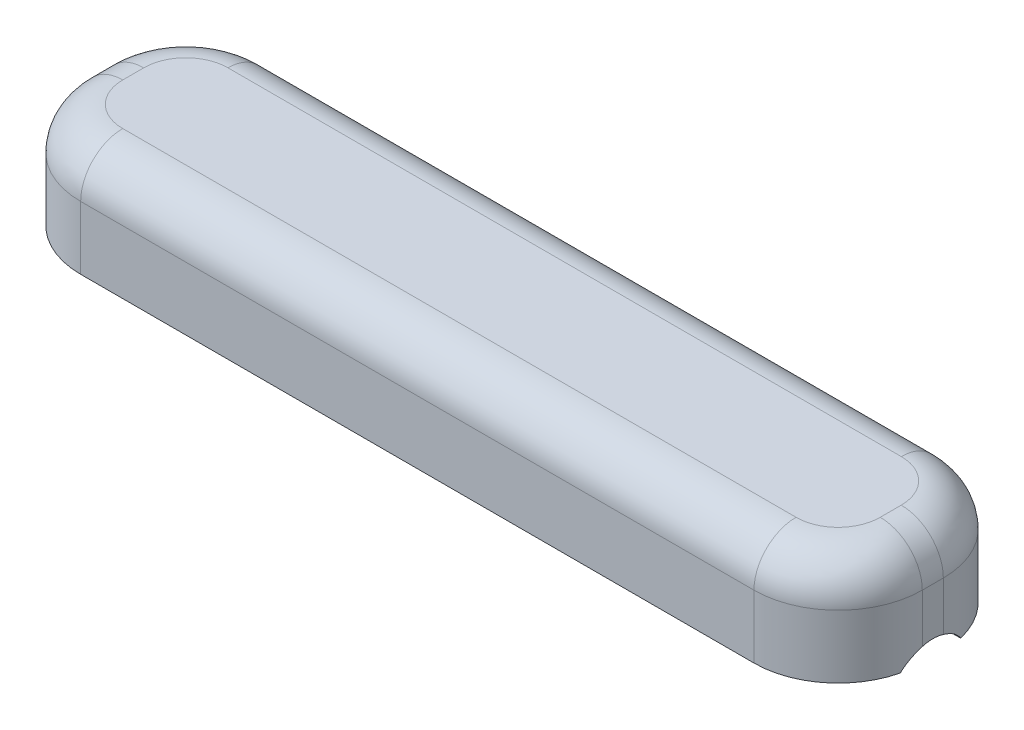
from build123d import *

# Parameters (mm, degrees)
SKETCH1_W               = 254
SKETCH1_H               = 57.15
BOSS_EXTRUDE1_DEPTH     = 31.75
FILLET1_R               = 12.7
FILLET2_R               = 25.4
CUT_EXTRUDE1_DEPTH      = 134.991018822
CUT_EXTRUDE1_DEPTH_BACK = 134.991018822
SKETCH2_R               = 11.1125


with BuildPart() as part:
    # Sketch1 → Boss-Extrude1 (new body)
    with BuildSketch(Plane(origin=(0, 0, 0), x_dir=(1, 0, 0), z_dir=(0, 1, 0))):
        Rectangle(SKETCH1_W, SKETCH1_H)
    extrude(amount=BOSS_EXTRUDE1_DEPTH)

    # Fillet1
    fillet1_edges = [part.edges().sort_by_distance(p)[0] for p in [
        (-127, 31.75, 0),
        (0, 31.75, 28.575),
        (127, 31.75, 0),
        (0, 31.75, -28.575),
    ]]
    fillet(fillet1_edges, radius=FILLET1_R)

    # Fillet2
    # the kernel refuses this fillet: 25.4 mm, written as the material it takes off along each edge
    with BuildSketch(Plane(origin=(101.6, 31.75, -3.175), x_dir=(1, 0, 0), z_dir=(0, 0, 1))) as fillet2_piece_1:
        with BuildLine():
            CenterArc((12.7, -12.7), 12.7, 0, 90)
            Line((25.4, -12.7), (25.4, 0))
            Line((25.4, 0), (12.7, 0))
        make_face()
    revolve(axis=Axis((101.6, 31.75, -3.175), (0, 1, 0)), revolution_arc=90, mode=Mode.SUBTRACT)
    with BuildSketch(Plane(origin=(101.6, 31.75, 3.175), x_dir=(0, 0, 1), z_dir=(-1, 0, 0))) as fillet2_piece_2:
        with BuildLine():
            CenterArc((12.7, -12.7), 12.7, 0, 90)
            Line((25.4, -12.7), (25.4, 0))
            Line((25.4, 0), (12.7, 0))
        make_face()
    revolve(axis=Axis((101.6, 31.75, 3.175), (0, 1, 0)), revolution_arc=90, mode=Mode.SUBTRACT)
    with BuildSketch(Plane(origin=(-101.6, 31.75, -3.175), x_dir=(0, 0, -1), z_dir=(1, 0, 0))) as fillet2_piece_3:
        with BuildLine():
            CenterArc((12.7, -12.7), 12.7, 0, 90)
            Line((25.4, -12.7), (25.4, 0))
            Line((25.4, 0), (12.7, 0))
        make_face()
    revolve(axis=Axis((-101.6, 31.75, -3.175), (0, 1, 0)), revolution_arc=90, mode=Mode.SUBTRACT)
    with BuildSketch(Plane(origin=(-101.6, 31.75, 3.175), x_dir=(-1, 0, 0), z_dir=(0, 0, -1))) as fillet2_piece_4:
        with BuildLine():
            CenterArc((12.7, -12.7), 12.7, 0, 90)
            Line((25.4, -12.7), (25.4, 0))
            Line((25.4, 0), (12.7, 0))
        make_face()
    revolve(axis=Axis((-101.6, 31.75, 3.175), (0, 1, 0)), revolution_arc=90, mode=Mode.SUBTRACT)
    with BuildSketch(Plane(origin=(-127, -63.5, 28.575), x_dir=(0, 0, -1), z_dir=(0, 1, 0)), Plane(origin=(-127, -63.5, -28.575), x_dir=(1, 0, 0), z_dir=(0, 1, 0))) as fillet2_piece_5:
        with BuildLine():
            CenterArc((FILLET2_R, -FILLET2_R), FILLET2_R, 90, 90)
            Line((0, -FILLET2_R), (0, 0))
            Line((0, 0), (FILLET2_R, 0))
        make_face()
    extrude(amount=95.25, mode=Mode.SUBTRACT)
    with BuildSketch(Plane(origin=(127, -63.5, -28.575), x_dir=(-1, 0, 0), z_dir=(0, 1, 0)), Plane(origin=(127, -63.5, 28.575), x_dir=(0, 0, -1), z_dir=(0, 1, 0))) as fillet2_piece_6:
        with BuildLine():
            CenterArc((FILLET2_R, FILLET2_R), FILLET2_R, 180, 90)
            Line((0, FILLET2_R), (0, 0))
            Line((0, 0), (FILLET2_R, 0))
        make_face()
    extrude(amount=95.25, mode=Mode.SUBTRACT)

    # Sketch2 → Cut-Extrude1 (cut, two sides: drawn at the far end of the back side and taken through both)
    with BuildSketch(Plane(origin=(0, 0, 0), x_dir=(0, 0, -1), z_dir=(1, 0, 0)).offset(-CUT_EXTRUDE1_DEPTH_BACK)):
        with Locations((0, -6.35)):
            Circle(SKETCH2_R)
    extrude(amount=CUT_EXTRUDE1_DEPTH + CUT_EXTRUDE1_DEPTH_BACK, mode=Mode.SUBTRACT)


solid = part.part
